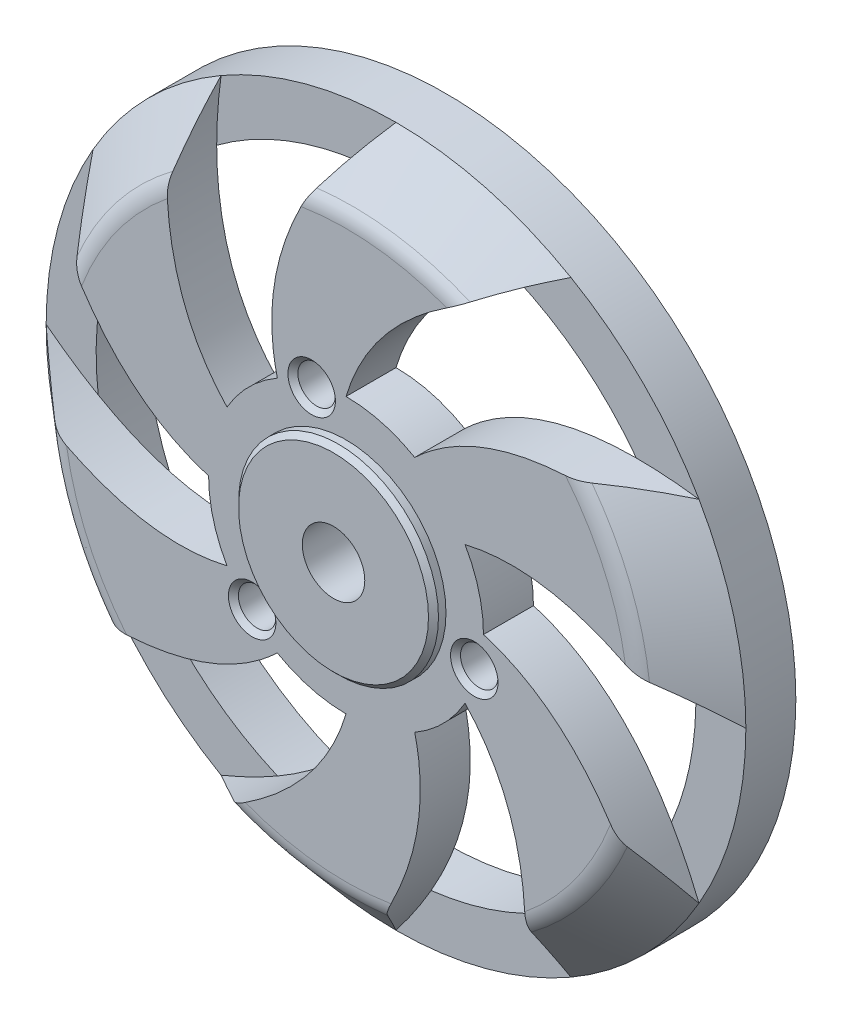
from build123d import *
from OCP.BRepFilletAPI import BRepFilletAPI_MakeChamfer

# Parameters (mm, degrees)
SKETCH1_R           = 14
SKETCH1_R_2         = 12
BOSS_EXTRUDE1_DEPTH = 2
BOSS_EXTRUDE2_DEPTH = 2
CHAMFER1_SIZE       = 2
CHAMFER1_SIZE_2     = 2.300736814
FILLET1_R           = 1
SKETCH3_R           = 4
BOSS_EXTRUDE3_DEPTH = 0.5
CHAMFER2_SIZE       = 0.2
CUT_EXTRUDE1_REACH  = 22.199
SKETCH4_R           = 0.75
CHAMFER3_SIZE       = 0.2
SKETCH5_R           = 1.25
CUT_EXTRUDE2_DEPTH  = 10


with BuildPart() as part:
    # Sketch1 → Boss-Extrude1 (new body)
    with BuildSketch(Plane.XY):
        Circle(SKETCH1_R)
        Circle(SKETCH1_R_2, mode=Mode.SUBTRACT)
    extrude(amount=BOSS_EXTRUDE1_DEPTH)

    # Sketch2 → Boss-Extrude2 (add)
    with BuildSketch(Plane.XY.offset(2)):
        with BuildLine():
            ThreePointArc((-2.75, 4.763139721), (-3.889087297, 3.889087297), (-4.763139721, 2.75))
            add(Edge.make_bspline(
                [(-4.763139721, 2.75), (-7.826418416, 5.986986658), (-7, 12.124355653)],
                knots=[0.363335237, 0.363335237, 0.363335237, 1, 1, 1], degree=2))
            ThreePointArc((-7, 12.124355653), (-9.899494937, 9.899494937), (-12.124355653, 7))
            add(Edge.make_bspline(
                [(-5.5, 0), (-9.771370498, 1.27167333), (-12.124355653, 7)],
                knots=[0.363335237, 0.363335237, 0.363335237, 1, 1, 1], degree=2))
            ThreePointArc((-5.5, 0), (-5.312592045, -1.423504748), (-4.763139721, -2.75))
            add(Edge.make_bspline(
                [(-4.763139721, -2.75), (-9.098091746, -3.78438384), (-14, 0)],
                knots=[0.363335237, 0.363335237, 0.363335237, 1, 1, 1], degree=2))
            ThreePointArc((-14, 0), (-13.522961568, -3.623466631), (-12.124355653, -7))
            add(Edge.make_bspline(
                [(-2.75, -4.763139721), (-5.986986658, -7.826418416), (-12.124355653, -7)],
                knots=[0.363335237, 0.363335237, 0.363335237, 1, 1, 1], degree=2))
            ThreePointArc((-2.75, -4.763139721), (-1.423504748, -5.312592045), (0, -5.5))
            add(Edge.make_bspline(
                [(0, -5.5), (-1.27167333, -9.771370498), (-7, -12.124355653)],
                knots=[0.363335237, 0.363335237, 0.363335237, 1, 1, 1], degree=2))
            ThreePointArc((-7, -12.124355653), (-3.623466631, -13.522961568), (0, -14))
            add(Edge.make_bspline(
                [(2.75, -4.763139721), (3.78438384, -9.098091746), (0, -14)],
                knots=[0.363335237, 0.363335237, 0.363335237, 1, 1, 1], degree=2))
            ThreePointArc((2.75, -4.763139721), (3.889087297, -3.889087297), (4.763139721, -2.75))
            add(Edge.make_bspline(
                [(4.763139721, -2.75), (7.826418416, -5.986986658), (7, -12.124355653)],
                knots=[0.363335237, 0.363335237, 0.363335237, 1, 1, 1], degree=2))
            ThreePointArc((7, -12.124355653), (9.899494937, -9.899494937), (12.124355653, -7))
            add(Edge.make_bspline(
                [(5.5, 0), (9.771370498, -1.27167333), (12.124355653, -7)],
                knots=[0.363335237, 0.363335237, 0.363335237, 1, 1, 1], degree=2))
            ThreePointArc((5.5, 0), (5.312592045, 1.423504748), (4.763139721, 2.75))
            add(Edge.make_bspline(
                [(4.763139721, 2.75), (9.098091746, 3.78438384), (14, 0)],
                knots=[0.363335237, 0.363335237, 0.363335237, 1, 1, 1], degree=2))
            ThreePointArc((14, 0), (13.522961568, 3.623466631), (12.124355653, 7))
            add(Edge.make_bspline(
                [(2.75, 4.763139721), (5.986986658, 7.826418416), (12.124355653, 7)],
                knots=[0.363335237, 0.363335237, 0.363335237, 1, 1, 1], degree=2))
            ThreePointArc((2.75, 4.763139721), (1.423504748, 5.312592045), (0, 5.5))
            add(Edge.make_bspline(
                [(0, 5.5), (1.27167333, 9.771370498), (7, 12.124355653)],
                knots=[0.363335237, 0.363335237, 0.363335237, 1, 1, 1], degree=2))
            ThreePointArc((7, 12.124355653), (3.623466631, 13.522961568), (0, 14))
            add(Edge.make_bspline(
                [(-2.75, 4.763139721), (-3.78438384, 9.098091746), (0, 14)],
                knots=[0.363335237, 0.363335237, 0.363335237, 1, 1, 1], degree=2))
        make_face()
    extrude(amount=BOSS_EXTRUDE2_DEPTH)

    # Chamfer1
    chamfer1_edges_1 = [part.edges().sort_by_distance(p)[0] for p in [
        (-9.899494937, 9.899494937, 4),
    ]]
    chamfer1_side_1 = [part.faces().sort_by_distance(p)[0] for p in [
        (-9.899494937, 9.899494937, 3.96),
    ]]
    chamfer1_edges_2 = [part.edges().sort_by_distance(p)[0] for p in [
        (-13.522961568, -3.623466631, 4),
    ]]
    chamfer1_side_2 = [part.faces().sort_by_distance(p)[0] for p in [
        (-13.522961568, -3.623466631, 3.96),
    ]]
    chamfer1_edges_3 = [part.edges().sort_by_distance(p)[0] for p in [
        (13.522961568, 3.623466631, 4),
    ]]
    chamfer1_side_3 = [part.faces().sort_by_distance(p)[0] for p in [
        (13.522961568, 3.623466631, 3.96),
    ]]
    chamfer1_edges_4 = [part.edges().sort_by_distance(p)[0] for p in [
        (3.623466631, 13.522961568, 4),
    ]]
    chamfer1_side_4 = [part.faces().sort_by_distance(p)[0] for p in [
        (3.623466631, 13.522961568, 3.96),
    ]]
    chamfer1_edges_5 = [part.edges().sort_by_distance(p)[0] for p in [
        (-3.623466631, -13.522961568, 4),
    ]]
    chamfer1_side_5 = [part.faces().sort_by_distance(p)[0] for p in [
        (-3.623466631, -13.522961568, 3.96),
    ]]
    chamfer1_edges_6 = [part.edges().sort_by_distance(p)[0] for p in [
        (9.899494937, -9.899494937, 4),
    ]]
    chamfer1_side_6 = [part.faces().sort_by_distance(p)[0] for p in [
        (9.899494937, -9.899494937, 3.96),
    ]]
    chamfer1 = BRepFilletAPI_MakeChamfer(part.part.solid().wrapped)
    for e in chamfer1_edges_1:
        chamfer1.Add(CHAMFER1_SIZE - 0.0001, CHAMFER1_SIZE_2 - 0.0001, e.wrapped, chamfer1_side_1[0].wrapped)
    for e in chamfer1_edges_2:
        chamfer1.Add(CHAMFER1_SIZE - 0.0001, CHAMFER1_SIZE_2 - 0.0001, e.wrapped, chamfer1_side_2[0].wrapped)
    for e in chamfer1_edges_3:
        chamfer1.Add(CHAMFER1_SIZE - 0.0001, CHAMFER1_SIZE_2 - 0.0001, e.wrapped, chamfer1_side_3[0].wrapped)
    for e in chamfer1_edges_4:
        chamfer1.Add(CHAMFER1_SIZE - 0.0001, CHAMFER1_SIZE_2 - 0.0001, e.wrapped, chamfer1_side_4[0].wrapped)
    for e in chamfer1_edges_5:
        chamfer1.Add(CHAMFER1_SIZE - 0.0001, CHAMFER1_SIZE_2 - 0.0001, e.wrapped, chamfer1_side_5[0].wrapped)
    for e in chamfer1_edges_6:
        chamfer1.Add(CHAMFER1_SIZE - 0.0001, CHAMFER1_SIZE_2 - 0.0001, e.wrapped, chamfer1_side_6[0].wrapped)
    add(Compound.cast(chamfer1.Shape()), mode=Mode.REPLACE)  # a hair under: the kernel refuses the full size

    # Fillet1
    fillet1_edges = [part.edges().sort_by_distance(p)[0] for p in [
        (10.785366658, 4.533317219, 4),
        (9.318651204, -7.073742906, 4),
        (-1.466715454, -11.607060125, 4),
        (-10.785366658, -4.533317219, 4),
        (-9.318651204, 7.073742906, 4),
        (1.466715454, 11.607060125, 4),
    ]]
    fillet(fillet1_edges, radius=FILLET1_R)

    # Sketch3 → Boss-Extrude3 (add)
    with BuildSketch(Plane.XY.offset(4)):
        Circle(SKETCH3_R)
    extrude(amount=BOSS_EXTRUDE3_DEPTH)

    # Chamfer2
    chamfer2_edges = [part.edges().sort_by_distance(p)[0] for p in [
        (-4, 0, 4.5),
    ]]
    chamfer(chamfer2_edges, length=CHAMFER2_SIZE)

    # Sketch4 → Cut-Extrude1 (cut, up to next)
    with BuildSketch(Plane.XY.offset(4), mode=Mode.PRIVATE) as cut_extrude1_sk1:
        with Locations((-1.375, 5.13156986)):
            Circle(SKETCH4_R)
    cut_extrude1_tool1 = extrude(cut_extrude1_sk1.sketch, amount=-CUT_EXTRUDE1_REACH, mode=Mode.PRIVATE) & part.part
    # Sketch4 → Cut-Extrude1 (cut, up to next)
    with BuildSketch(Plane.XY.offset(4), mode=Mode.PRIVATE) as cut_extrude1_sk2:
        with Locations((5.13156986, -1.375)):
            Circle(SKETCH4_R)
    cut_extrude1_tool2 = extrude(cut_extrude1_sk2.sketch, amount=-CUT_EXTRUDE1_REACH, mode=Mode.PRIVATE) & part.part
    # Sketch4 → Cut-Extrude1 (cut, up to next)
    with BuildSketch(Plane.XY.offset(4), mode=Mode.PRIVATE) as cut_extrude1_sk3:
        with Locations((-3.75656986, -3.75656986)):
            Circle(SKETCH4_R)
    cut_extrude1_tool3 = extrude(cut_extrude1_sk3.sketch, amount=-CUT_EXTRUDE1_REACH, mode=Mode.PRIVATE) & part.part
    add(cut_extrude1_tool1.solids().sort_by_distance((-1.375, 5.13157, 4))[0], mode=Mode.SUBTRACT)
    add(cut_extrude1_tool2.solids().sort_by_distance((5.13157, -1.375, 4))[0], mode=Mode.SUBTRACT)
    add(cut_extrude1_tool3.solids().sort_by_distance((-3.75657, -3.75657, 4))[0], mode=Mode.SUBTRACT)

    # Chamfer3
    chamfer3_edges = [part.edges().sort_by_distance(p)[0] for p in [
        (-2.125, 5.13156986, 4),
        (4.38156986, -1.375, 4),
        (-4.50656986, -3.75656986, 4),
    ]]
    chamfer(chamfer3_edges, length=CHAMFER3_SIZE)

    # Sketch5 → Cut-Extrude2 (cut)
    with BuildSketch(Plane.XY.offset(4.5)):
        Circle(SKETCH5_R)
    extrude(amount=-CUT_EXTRUDE2_DEPTH, mode=Mode.SUBTRACT)


solid = part.part
